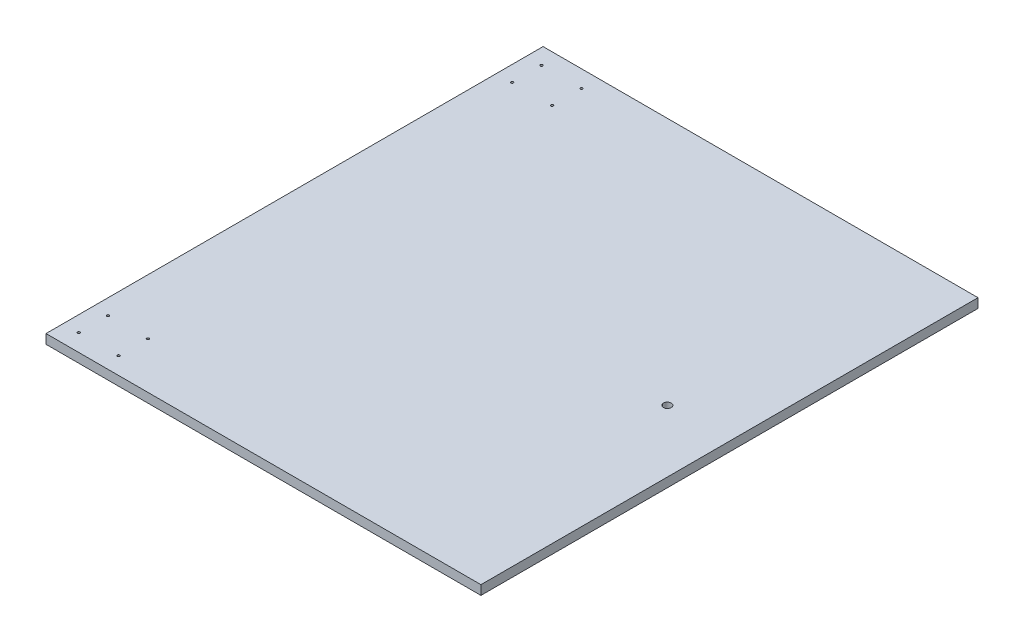
from build123d import *

# Parameters (mm, degrees)
SKETCH1_W           = 533.4
SKETCH1_H           = 609.6
BOSS_EXTRUDE1_DEPTH = 11.4554
SKETCH3_R           = 4.826
SKETCH3_R_2         = 1.5
CUT_EXTRUDE1_DEPTH  = 406.170527296


with BuildPart() as part:
    # Sketch1 → Boss-Extrude1 (new body)
    with BuildSketch(Plane(origin=(0, 0, 0), x_dir=(1, 0, 0), z_dir=(0, 1, 0))):
        Rectangle(SKETCH1_W, SKETCH1_H)
    extrude(amount=BOSS_EXTRUDE1_DEPTH)

    # Sketch3 → Cut-Extrude1 (cut, through all)
    with BuildSketch(Plane(origin=(0, 11.4554, 0), x_dir=(1, 0, 0), z_dir=(0, 1, 0))):
        with Locations((190.5, 0)):
            Circle(SKETCH3_R)
        with Locations((-198.65, 283.8)):
            Circle(SKETCH3_R_2)
        with Locations((-247.65, 283.8)):
            Circle(SKETCH3_R_2)
        with Locations((-247.65, 247.8)):
            Circle(SKETCH3_R_2)
        with Locations((-198.65, 247.8)):
            Circle(SKETCH3_R_2)
        with Locations((-198.65, -247.8)):
            Circle(SKETCH3_R_2)
        with Locations((-247.65, -247.8)):
            Circle(SKETCH3_R_2)
        with Locations((-247.65, -283.8)):
            Circle(SKETCH3_R_2)
        with Locations((-198.65, -283.8)):
            Circle(SKETCH3_R_2)
    extrude(amount=-CUT_EXTRUDE1_DEPTH, mode=Mode.SUBTRACT)


solid = part.part
